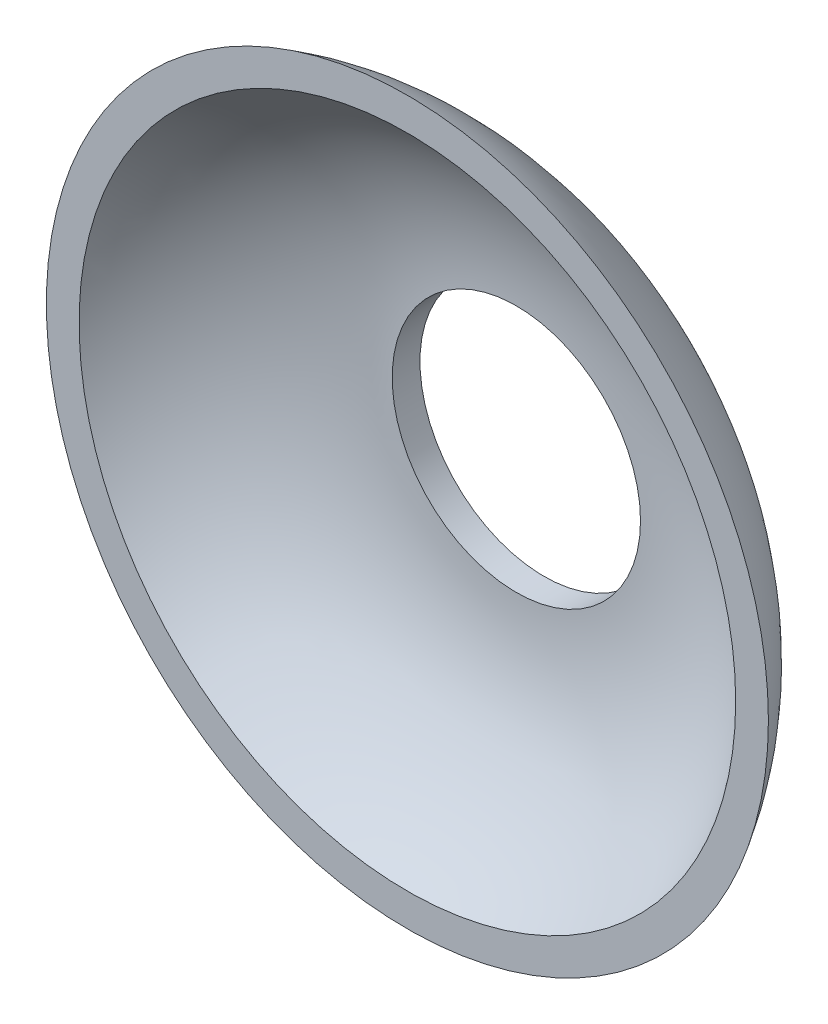
from build123d import *

# Parameters (mm, degrees)
SKETCH1_R           = 33
BOSS_EXTRUDE1_DEPTH = 12.5
FILLET1_R           = 25


# Read off the part's stored shape, not the designer's step: Shell1
with BuildPart() as part:
    # Sketch1 → Boss-Extrude1 (new body)
    with BuildSketch(Plane.XY):
        Circle(SKETCH1_R)
    extrude(amount=BOSS_EXTRUDE1_DEPTH)

    # Fillet1
    # the kernel refuses this fillet: 25 mm, written as the material it takes off along each edge
    with BuildSketch(Plane(origin=(0, 0, 0), x_dir=(1, 0, 0), z_dir=(0, -1, 0))) as fillet1_piece_1:
        with BuildLine():
            CenterArc((11.349364905, 25), FILLET1_R, 270, 60)
            Line((11.349364905, 0), (11.349364905, -0.5))
            Line((11.349364905, -0.5), (33, -0.5))
            Line((33, -0.5), (33.5, 0))
            ThreePointArc((33.5, 0), (33.5, 6.25), (33.433012702, 12.25))
            Line((33.433012702, 12.25), (33, 12.5))
        make_face()
    revolve(axis=Axis((0, 0, 0), (0, 0, 1)), mode=Mode.SUBTRACT)

    # Shell1 outline → Shell1 (revolve, cut)
    with BuildSketch(Plane.XZ):
        with BuildLine():
            Line((0, 0), (11.349364905, 0))
            Line((11.349364905, 0), (11.349364905, 2.54))
            ThreePointArc((11.349364905, 2.54), (21.925318763, 5.185843445), (30.009525676, 12.5))
            Line((30.009525676, 12.5), (0, 12.5))
            Line((0, 12.5), (0, 0))
        make_face()
    revolve(axis=Axis((0, 0, 0), (0, 0, 1)), mode=Mode.SUBTRACT)


solid = part.part
